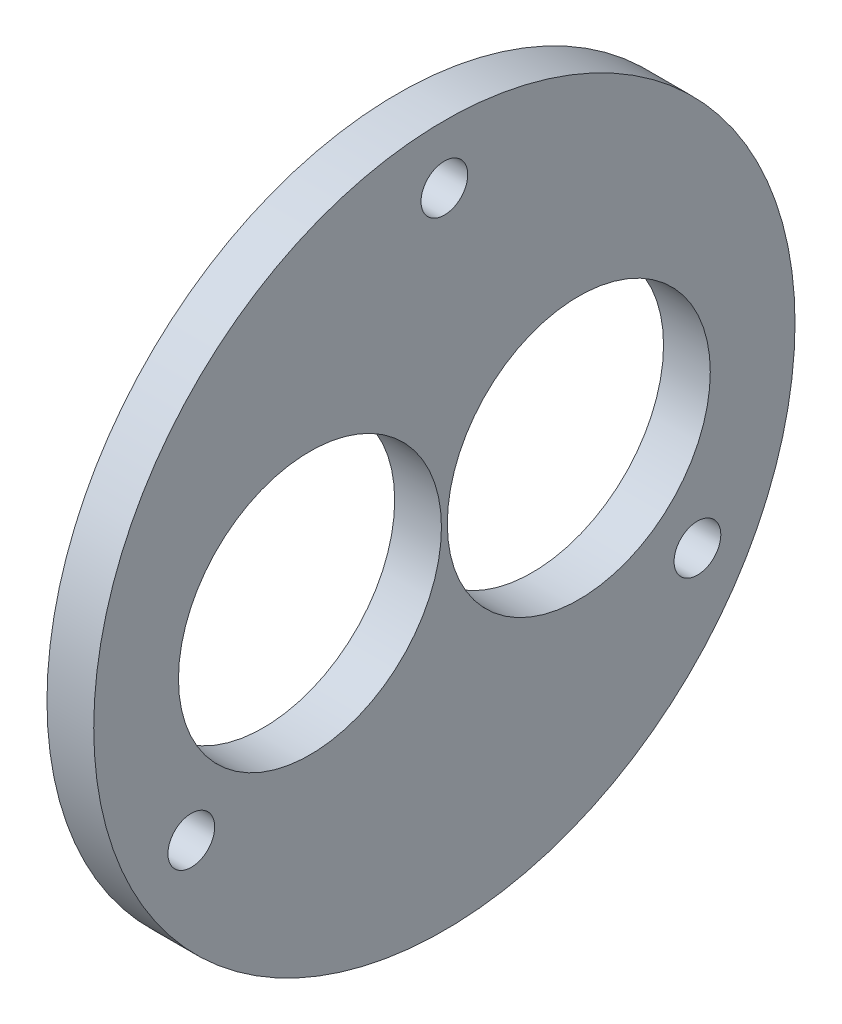
from build123d import *

# Parameters (mm, degrees)
SKETCH1_R           = 60
SKETCH1_R_2         = 4
SKETCH1_R_3         = 22.5
BOSS_EXTRUDE1_DEPTH = 8


with BuildPart() as part:
    # Sketch1 → Boss-Extrude1 (new body)
    with BuildSketch(Plane(origin=(0, 0, 0), x_dir=(0, 0, -1), z_dir=(1, 0, 0))):
        Circle(SKETCH1_R)
        with Locations((0, 50)):
            Circle(SKETCH1_R_2, mode=Mode.SUBTRACT)
        with Locations((43.301270189, -25)):
            Circle(SKETCH1_R_2, mode=Mode.SUBTRACT)
        with Locations((-43.301270189, -25)):
            Circle(SKETCH1_R_2, mode=Mode.SUBTRACT)
        with Locations((-23, 0)):
            Circle(SKETCH1_R_3, mode=Mode.SUBTRACT)
        with Locations((23, 0)):
            Circle(SKETCH1_R_3, mode=Mode.SUBTRACT)
    extrude(amount=BOSS_EXTRUDE1_DEPTH)


solid = part.part
